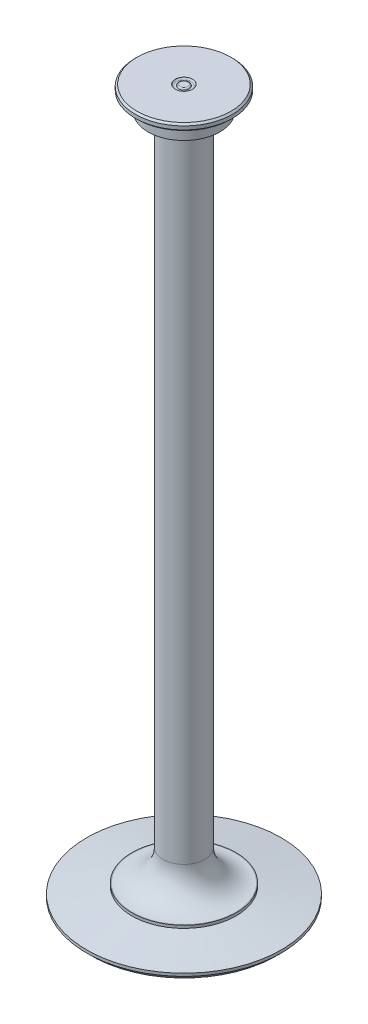
from build123d import *

# Parameters (mm, degrees)
CROQUIS2_R              = 3
SALIENTE_EXTRUIR1_DEPTH = 17.61
CROQUIS3_R              = 7
CROQUIS3_R_2            = 3
SALIENTE_EXTRUIR2_DEPTH = 1
CHAFL_N1_SIZE           = 0.25
CROQUIS4_R              = 14
SALIENTE_EXTRUIR3_DEPTH = 1.5
CHAFL_N2_SIZE           = 0.7
REDONDEO3_R             = 4.4
CROQUIS6_R              = 1.25
CROQUIS6_R_2            = 0.75
CORTAR_EXTRUIR1_DEPTH   = 0.2
REDONDEO4_R             = 0.2
REDONDEO5_R             = 0.2
SALIENTE_EXTRUIR4_START = 2.36
CROQUIS7_R              = 5.175
CROQUIS7_R_2            = 3
SALIENTE_EXTRUIR4_DEPTH = 2.36


with BuildPart() as part:
    # Croquis1 → Revolución1 (revolve)
    with BuildSketch(Plane.XY, mode=Mode.PRIVATE) as revoluci_n1_sk:
        Polygon((-3, 0.98), (-7.5, 0.98), (-14, 0), (0, 0), (0, 82.891267921), (-3, 82.891267921), align=None)
    revolve(revoluci_n1_sk.sketch.rotate(Axis((0, 0, 0), (0, 1, 0)), 270), axis=Axis((0, 0, 0), (0, 1, 0)))

    # Croquis2 → Saliente-Extruir1 (add)
    with BuildSketch(Plane(origin=(0, 82.891267921, 0), x_dir=(1, 0, 0), z_dir=(0, 1, 0))):
        with Locations(Location((0, 0, 0), (0, 0, 90))):
            Circle(CROQUIS2_R)
    extrude(amount=SALIENTE_EXTRUIR1_DEPTH)

    # Croquis3 → Saliente-Extruir2 (add)
    with BuildSketch(Plane(origin=(0, 99.501267921, 0), x_dir=(1, 0, 0), z_dir=(0, 1, 0))):
        with Locations(Location((0, 0, 0), (0, 0, 90))):
            Circle(CROQUIS3_R)
        with Locations(Location((0, 0, 0), (0, 0, 90))):
            Circle(CROQUIS3_R_2, mode=Mode.SUBTRACT)
    extrude(amount=SALIENTE_EXTRUIR2_DEPTH)

    # Chaflán1
    chafl_n1_edges = [part.edges().sort_by_distance(p)[0] for p in [
        (0, 99.501267921, 7),
        (0, 100.501267921, 7),
    ]]
    chamfer(chafl_n1_edges, length=CHAFL_N1_SIZE)

    # Croquis4 → Saliente-Extruir3 (add)
    with BuildSketch(Plane.XZ):
        with Locations(Location((0, 0, 0), (0, 0, 270))):
            Circle(CROQUIS4_R)
    extrude(amount=SALIENTE_EXTRUIR3_DEPTH)

    # Chaflán2
    chafl_n2_edges = [part.edges().sort_by_distance(p)[0] for p in [
        (0, -1.5, 14),
    ]]
    chamfer(chafl_n2_edges, length=CHAFL_N2_SIZE)

    # Redondeo3
    redondeo3_edges = [part.edges().sort_by_distance(p)[0] for p in [
        (0, 0.98, 3),
    ]]
    fillet(redondeo3_edges, radius=REDONDEO3_R)

    # Croquis5 → Cortar-Revolución1 (revolve, cut)
    with BuildSketch(Plane(origin=(0, 0, 0), x_dir=(0, 0, -1), z_dir=(1, 0, 0)), mode=Mode.PRIVATE) as cortar_revoluci_n1_sk:
        Polygon((-7.5, 0.98), (-14, 0), (-14, -0.4), (-7.5, 0.58264143), align=None)
    revolve(cortar_revoluci_n1_sk.sketch.rotate(Axis((0, 0, 0), (0, 1, 0)), 180), axis=Axis((0, 0, 0), (0, 1, 0)), mode=Mode.SUBTRACT)

    # Croquis6 → Cortar-Extruir1 (cut)
    with BuildSketch(Plane(origin=(0, 100.501267921, 0), x_dir=(1, 0, 0), z_dir=(0, 1, 0))):
        with Locations(Location((0, 0, 0), (0, 0, 270))):
            Circle(CROQUIS6_R)
        with Locations(Location((0, 0, 0), (0, 0, 270))):
            Circle(CROQUIS6_R_2, mode=Mode.SUBTRACT)
    extrude(amount=-CORTAR_EXTRUIR1_DEPTH, mode=Mode.SUBTRACT)

    # Redondeo4
    redondeo4_edges = [part.edges().sort_by_distance(p)[0] for p in [
        (0, 100.301267921, -1.25),
    ]]
    fillet(redondeo4_edges, radius=REDONDEO4_R - 0.0001)  # a hair under: the kernel refuses the full size

    # Redondeo5
    redondeo5_edges = [part.edges().sort_by_distance(p)[0] for p in [
        (0, 100.501267921, -0.75),
    ]]
    fillet(redondeo5_edges, radius=REDONDEO5_R - 0.0001)  # a hair under: the kernel refuses the full size

    # Croquis7 → Saliente-Extruir4 (add)
    with BuildSketch(Plane.XZ.offset(-99.501267921).offset(SALIENTE_EXTRUIR4_START)):
        with Locations(Location((0, 0, 0), (0, 0, 90))):
            Circle(CROQUIS7_R)
        with Locations(Location((0, 0, 0), (0, 0, 270))):
            Circle(CROQUIS7_R_2, mode=Mode.SUBTRACT)
    extrude(amount=-SALIENTE_EXTRUIR4_DEPTH)


solid = part.part
